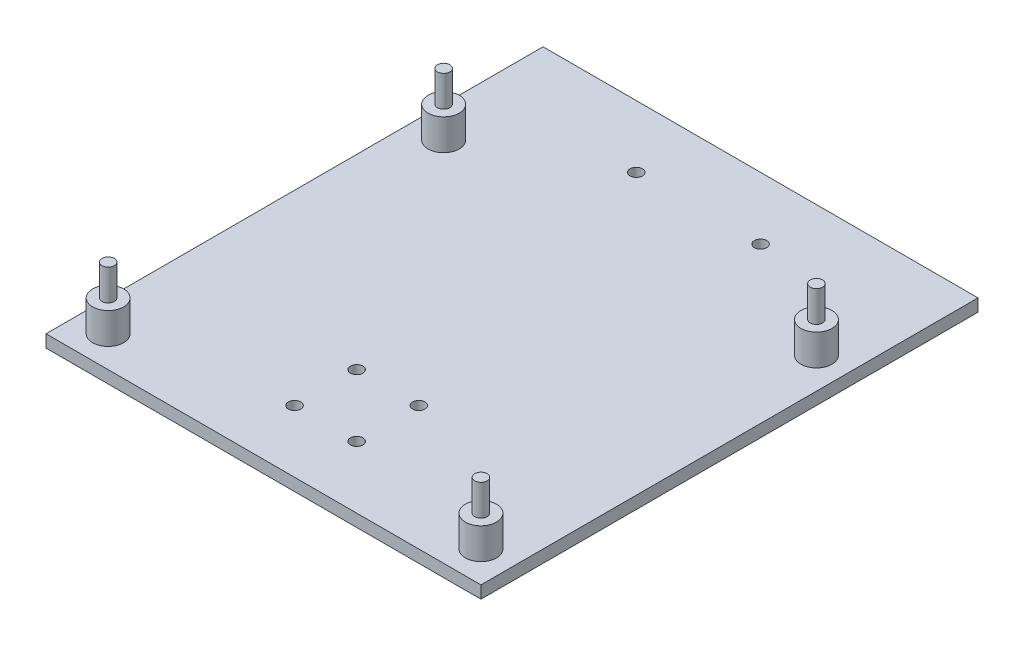
from build123d import *

# Parameters (mm, degrees)
BOSS_EXTRUDE1_OUTLINE_W = 70
BOSS_EXTRUDE1_OUTLINE_H = 80
BOSS_EXTRUDE1_DEPTH     = 2
SKETCH2_R               = 2.5
BOSS_EXTRUDE2_DEPTH     = 5
SKETCH3_R               = 1
BOSS_EXTRUDE3_DEPTH     = 5
SKETCH4_R               = 1
CUT_EXTRUDE1_DEPTH      = 55.083269132
SKETCH5_R               = 1
CUT_EXTRUDE2_DEPTH      = 55.083269132


# Read off the part's stored shape, not the designer's step: Boss-Extrude1
with BuildPart() as part:
    # Boss-Extrude1 outline → Boss-Extrude1 (new body)
    with BuildSketch(Plane(origin=(0, 0, 0), x_dir=(1, 0, 0), z_dir=(0, 1, 0))):
        Rectangle(BOSS_EXTRUDE1_OUTLINE_W, BOSS_EXTRUDE1_OUTLINE_H)
    extrude(amount=BOSS_EXTRUDE1_DEPTH)

    # Sketch2 → Boss-Extrude2 (add)
    with BuildSketch(Plane(origin=(0, 2, 0), x_dir=(1, 0, 0), z_dir=(0, 1, 0))):
        with Locations(Location((-30, 19, 0), (0, 0, 270))):
            Circle(SKETCH2_R)
        with Locations(Location((30, 19, 0), (0, 0, 270))):
            Circle(SKETCH2_R)
        with Locations(Location((-30, -35, 0), (0, 0, 270))):
            Circle(SKETCH2_R)
        with Locations(Location((30, -35, 0), (0, 0, 270))):
            Circle(SKETCH2_R)
    extrude(amount=BOSS_EXTRUDE2_DEPTH)

    # Sketch3 → Boss-Extrude3 (add)
    with BuildSketch(Plane(origin=(0, 7, 0), x_dir=(1, 0, 0), z_dir=(0, 1, 0))):
        with Locations(Location((-30, 19, 0), (0, 0, 270))):
            Circle(SKETCH3_R)
        with Locations(Location((30, 19, 0), (0, 0, 270))):
            Circle(SKETCH3_R)
        with Locations(Location((30, -35, 0), (0, 0, 270))):
            Circle(SKETCH3_R)
        with Locations(Location((-30, -35, 0), (0, 0, 270))):
            Circle(SKETCH3_R)
    extrude(amount=BOSS_EXTRUDE3_DEPTH)

    # Sketch4 → Cut-Extrude1 (cut, through all)
    with BuildSketch(Plane(origin=(0, 2, 0), x_dir=(1, 0, 0), z_dir=(0, 1, 0))):
        with Locations(Location((-5, -30, 0), (0, 0, 270))):
            Circle(SKETCH4_R)
        with Locations(Location((-5, -20, 0), (0, 0, 270))):
            Circle(SKETCH4_R)
        with Locations(Location((5, -20, 0), (0, 0, 270))):
            Circle(SKETCH4_R)
        with Locations(Location((5, -30, 0), (0, 0, 270))):
            Circle(SKETCH4_R)
    extrude(amount=-CUT_EXTRUDE1_DEPTH, mode=Mode.SUBTRACT)

    # Sketch5 → Cut-Extrude2 (cut, through all)
    with BuildSketch(Plane(origin=(0, 2, 0), x_dir=(1, 0, 0), z_dir=(0, 1, 0))):
        with Locations(Location((-10, 30, 0), (0, 0, 270))):
            Circle(SKETCH5_R)
        with Locations(Location((10, 30, 0), (0, 0, 270))):
            Circle(SKETCH5_R)
    extrude(amount=-CUT_EXTRUDE2_DEPTH, mode=Mode.SUBTRACT)


solid = part.part
